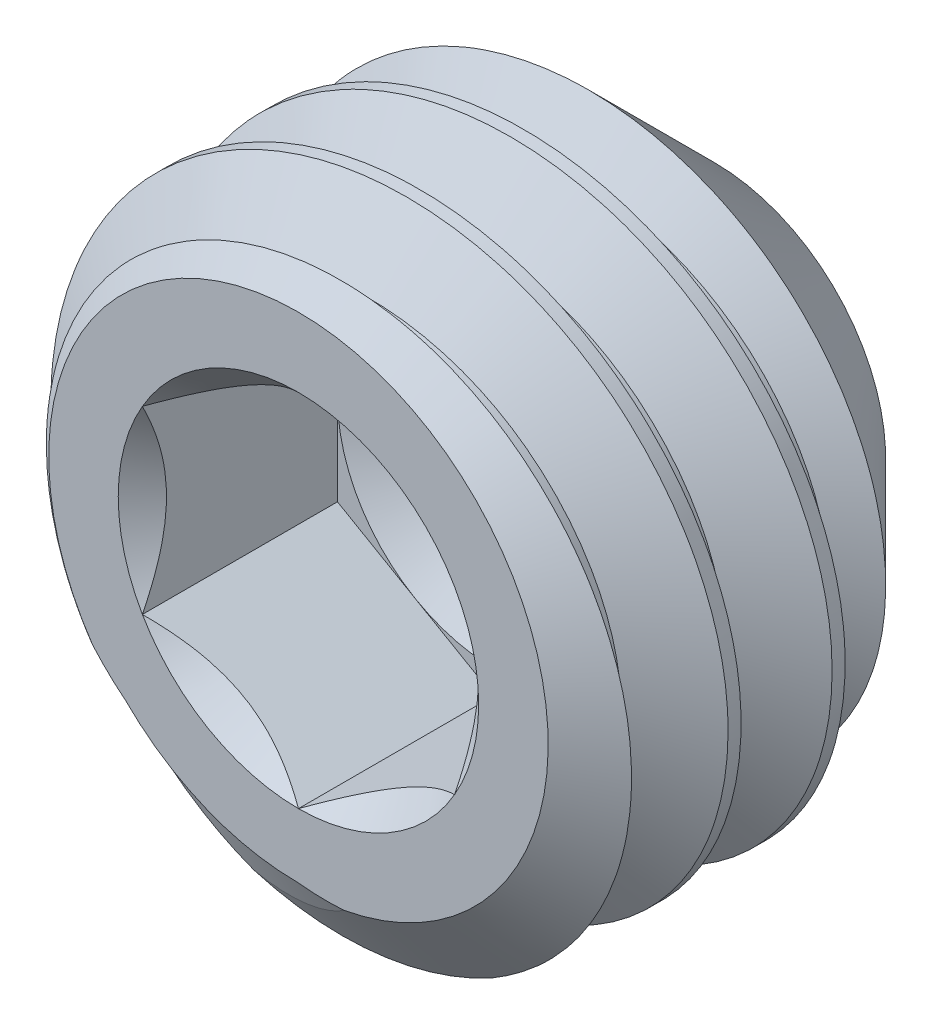
from build123d import *

# Parameters (mm, degrees)
CUT_EXTRUDE10_DEPTH = 2.9765625
CUT_SWEEP1_PITCH    = 1.5875


with BuildPart() as part:
    # Sketch22 → Revolve1 (revolve)
    with BuildSketch(Plane(origin=(0, 0, 0), x_dir=(0, 0, -1), z_dir=(1, 0, 0)), mode=Mode.PRIVATE) as revolve1_sk:
        Polygon((-2.390972169, 0), (-2.390972169, 3.81), (-1.724024489, 4.7625), (1.806210697, 4.7625), (3.959027831, 2.609682866), (2.390972169, 0), align=None)
    revolve(revolve1_sk.sketch.rotate(Axis((0, 0, -2.390972169), (0, 0, -1)), 180), axis=Axis((0, 0, -2.390972169), (0, 0, -1)))

    # Sketch23 → Cut-Extrude10 (cut)
    with BuildSketch(Plane.XY.offset(2.390972169)):
        Polygon((0, 2.749630657), (-2.38125, 1.374815329), (-2.38125, -1.374815329), (0, -2.749630657), (2.38125, -1.374815329), (2.38125, 1.374815329), align=None)
    extrude(amount=-CUT_EXTRUDE10_DEPTH, mode=Mode.SUBTRACT)

    # Cut-Extrude11 cone 1 section (through the dimple's axis) → Cut-Extrude11 (revolve, cut)
    with BuildSketch(Plane(origin=(0, 0, 2.390972169), x_dir=(0, -1, 0), z_dir=(1, 0, 0))):
        Polygon((0, 0), (2.749630657, 0), (0, 2.749630657), align=None)
    revolve(axis=Axis((0, 0, 2.390972169), (0, 0, -1)), mode=Mode.SUBTRACT)

    # Cut-Extrude12 cone 1 section (through the dimple's axis) → Cut-Extrude12 (revolve, cut)
    with BuildSketch(Plane(origin=(0, 0, -0.585590331), x_dir=(0, -1, 0), z_dir=(1, 0, 0))):
        Polygon((0, 0), (2.38125, 0), (0, 1.374815329), align=None)
    revolve(axis=Axis((0, 0, -0.585590331), (0, 0, -1)), mode=Mode.SUBTRACT)

    # Cut-Sweep1: the profile of Sketch32 screwed along a right-hand helix of 5 turns, 8 arcs to a turn; built about Z, then put on its axis
    cut_sweep1_z = Axis((0, 0, 0), (0, 0, 1))
    cut_sweep1_corners = [(3.731388504, 0, -0.5953125), (3.731388504, 0, -0.79375), (4.848425958, 0, -1.438671875), (4.848425958, 0, 0.049609375)]
    with BuildLine(mode=Mode.PRIVATE) as cut_sweep1_profile:
        Line(cut_sweep1_corners[0], cut_sweep1_corners[1])
        Line(cut_sweep1_corners[1], cut_sweep1_corners[2])
        Line(cut_sweep1_corners[2], cut_sweep1_corners[3])
        Line(cut_sweep1_corners[3], cut_sweep1_corners[0])
    cut_sweep1_cap = Face(cut_sweep1_profile.wire())
    cut_sweep1_turn_angles = [0, 22.5, 45, 67.5, 90, 112.5, 135, 157.5, 180, 202.5, 225, 247.5, 270, 292.5, 315, 337.5, 360]
    cut_sweep1_turn_weights = [1, 0.9238795325112867, 1, 0.9238795325112867, 1, 0.9238795325112867, 1, 0.9238795325112867, 1, 0.9238795325112867, 1, 0.9238795325112867, 1, 0.9238795325112867, 1, 0.9238795325112867, 1]
    cut_sweep1_turn_rails = [Edge.make_bspline([Vector(p[0], p[1], 0).rotate(cut_sweep1_z, cut_sweep1_turn_angles[k]) / cut_sweep1_turn_weights[k] + Vector(0, 0, p[2] + CUT_SWEEP1_PITCH * cut_sweep1_turn_angles[k] / 360) for k in range(17)], [0, 0, 0, 1, 1, 2, 2, 3, 3, 4, 4, 5, 5, 6, 6, 7, 7, 8, 8, 8], 2, cut_sweep1_turn_weights) for p in cut_sweep1_corners]
    cut_sweep1_turn_sides = [Face.make_surface_from_curves(cut_sweep1_turn_rails[p[0]], cut_sweep1_turn_rails[p[1]]) for p in [(0, 1), (1, 2), (2, 3), (3, 0)]]
    cut_sweep1 = Plane(origin=(0, 0, -3.959027831), x_dir=(0, 1, 0), z_dir=(0, 0, 1)) * Solid(Shell([*[p.moved(Location((0, 0, CUT_SWEEP1_PITCH * i))) for i in range(5) for p in cut_sweep1_turn_sides], cut_sweep1_cap, cut_sweep1_cap.rotate(cut_sweep1_z, 1800).moved(Location((0, 0, CUT_SWEEP1_PITCH * 1800 / 360)))]))
    add(cut_sweep1, mode=Mode.SUBTRACT)


solid = part.part
